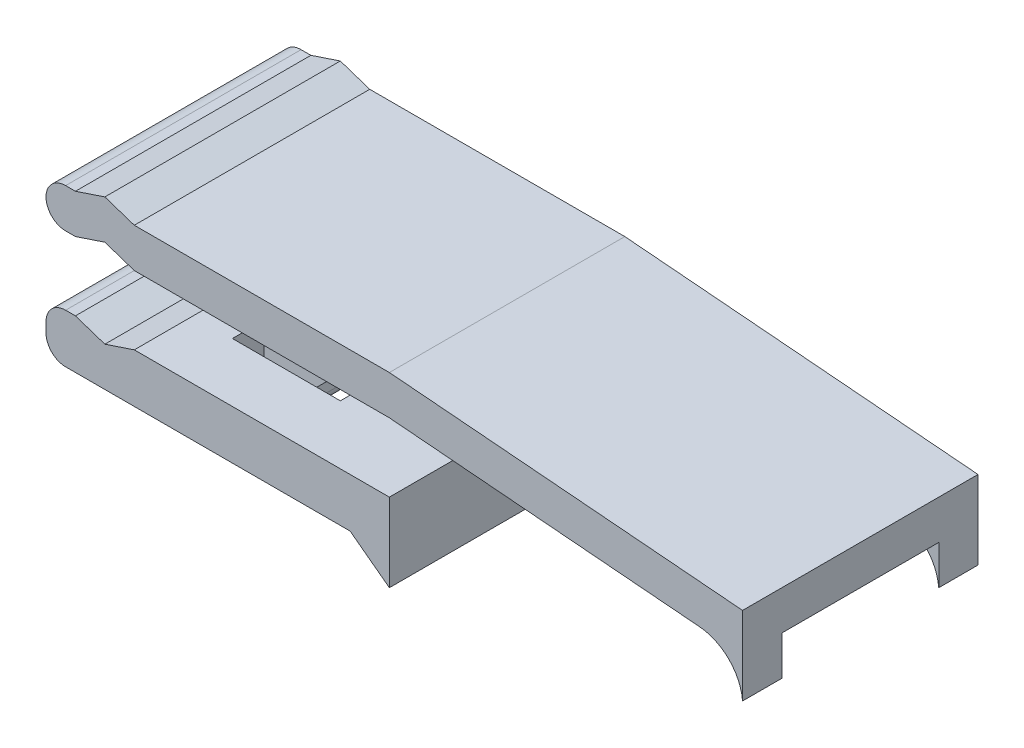
from build123d import *

# Parameters (mm, degrees)
BOSS_EXTRUDE1_DEPTH   = 12
BOSS_EXTRUDE1_2_DEPTH = 12
SKETCH2_W             = 5.5
SKETCH2_H             = 6
CUT_EXTRUDE1_DEPTH    = 3
BOSS_EXTRUDE2_DEPTH   = 6
BOSS_EXTRUDE3_START   = -6
BOSS_EXTRUDE3_DEPTH   = 2.5
FILLET7_R             = 1
FILLET8_R             = 1
FILLET10_R            = 1
FILLET11_R            = 1
BOSS_EXTRUDE4_DEPTH   = 2
BOSS_EXTRUDE5_START   = -10
BOSS_EXTRUDE5_DEPTH   = 2
FILLET12_R            = 0.5
FILLET13_R            = 0.5


with BuildPart() as part:
    # Sketch1 → Boss-Extrude1 (new body)
    with BuildSketch(Plane.XY):
        Polygon((0, 4), (-18, 5.5), (-31, 5.5), (-32.5, 6), (-34, 5.5), (-35.5, 5.5), (-35.5, 3.5), (-34, 3.5), (-32.5, 4), (-31, 3.5), (-18, 3.5), (0, 2), align=None)
    extrude(amount=BOSS_EXTRUDE1_DEPTH)

    # Sketch4 → Boss-Extrude3 (add, symmetric)
    with BuildSketch(Plane.XY.offset(12).offset(BOSS_EXTRUDE3_START)):
        with BuildLine():
            Line((-26.7, -2), (-24.7, 0))
            Line((-24.7, 0), (-24.7, 0.5))
            Line((-24.7, 0.5), (-26.2, 0.5))
            Line((-26.2, 0.5), (-26.2, 1.2))
            Line((-26.2, 1.2), (-23.9, 3.5))
            Line((-23.9, 3.5), (-26.304163056, 3.5))
            Line((-26.304163056, 3.5), (-27.402081528, 2.402081528))
            ThreePointArc((-27.402081528, 2.402081528), (-27.770595205, 1.850561835), (-27.9, 1.2))
            Line((-27.9, 1.2), (-27.9, -3))
            Line((-27.9, -3), (-26.7, -3))
            Line((-26.7, -3), (-26.7, -2))
        make_face()
    extrude(amount=BOSS_EXTRUDE3_DEPTH, both=True)

    # Fillet8
    fillet8_edges = [part.edges().sort_by_distance(p)[0] for p in [
        (-35.5, 3.5, 6),
    ]]
    fillet(fillet8_edges, radius=FILLET8_R)

    # Fillet10
    fillet10_edges = [part.edges().sort_by_distance(p)[0] for p in [
        (-35.5, 5.5, 6),
    ]]
    fillet(fillet10_edges, radius=FILLET10_R - 0.0001)  # a hair under: the kernel refuses the full size

    # Sketch5 → Boss-Extrude4 (add)
    with BuildSketch(Plane.XY.offset(12)):
        with BuildLine():
            Line((0, 2), (0, 0))
            ThreePointArc((0, 0), (-0.691300526, 1.490517656), (-2.181818182, 2.181818182))
            Line((-2.181818182, 2.181818182), (0, 2))
        make_face()
    extrude(amount=-BOSS_EXTRUDE4_DEPTH)

    # Sketch5<2> → Boss-Extrude5 (add)
    with BuildSketch(Plane.XY.offset(12).offset(BOSS_EXTRUDE5_START)):
        with BuildLine():
            Line((0, 2), (0, 0))
            ThreePointArc((0, 0), (-0.691300526, 1.490517656), (-2.181818182, 2.181818182))
            Line((-2.181818182, 2.181818182), (0, 2))
        make_face()
    extrude(amount=-BOSS_EXTRUDE5_DEPTH)

    # Fillet12
    fillet12_edges = [part.edges().sort_by_distance(p)[0] for p in [
        (-26.7, -3, 6),
        (-27.9, -3, 6),
    ]]
    fillet(fillet12_edges, radius=FILLET12_R)

    # Fillet13
    fillet13_edges = [part.edges().sort_by_distance(p)[0] for p in [
        (-26.2, 1.2, 6),
    ]]
    fillet(fillet13_edges, radius=FILLET13_R)


with BuildPart() as body_2:
    # Sketch1 → Boss-Extrude1 2 (new body)
    with BuildSketch(Plane.XY):
        Polygon((-35.5, -2.5), (-20, -2.5), (-18, -4), (-18, 0), (-31, 0), (-32.5, -0.5), (-34, 0), (-35.5, 0), align=None)
    extrude(amount=BOSS_EXTRUDE1_2_DEPTH)

    # Sketch2 → Cut-Extrude1 (cut)
    with BuildSketch(Plane.XZ.offset(2.5)):
        with Locations((-26.25, 6)):
            Rectangle(SKETCH2_W, SKETCH2_H)
    extrude(amount=-CUT_EXTRUDE1_DEPTH, mode=Mode.SUBTRACT)

    # Sketch3 → Boss-Extrude2 (add)
    with BuildSketch(Plane.XY.offset(3)):
        Polygon((-23.5, 0), (-25.5, -2), (-25.5, -2.5), (-23.5, -2.5), align=None)
    extrude(amount=BOSS_EXTRUDE2_DEPTH)

    # Fillet7
    fillet7_edges = [body_2.edges().sort_by_distance(p)[0] for p in [
        (-35.5, 0, 6),
    ]]
    fillet(fillet7_edges, radius=FILLET7_R)

    # Fillet11
    fillet11_edges = [body_2.edges().sort_by_distance(p)[0] for p in [
        (-35.5, -2.5, 6),
    ]]
    fillet(fillet11_edges, radius=FILLET11_R)


solid = Compound([part.part, body_2.part])
